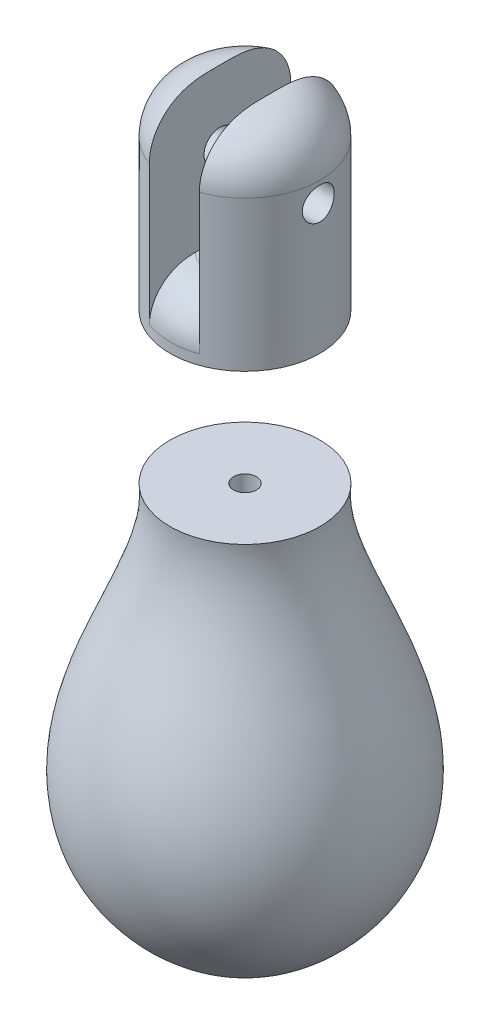
from build123d import *

# Parameters (mm, degrees)
SKETCH1_R               = 7.5
BOSS_EXTRUDE1_DEPTH     = 20
SKETCH2_W               = 15
SKETCH2_H               = 15
CUT_EXTRUDE1_DEPTH      = 2.5
CUT_EXTRUDE2_DEPTH      = 46.499865857
CUT_EXTRUDE2_DEPTH_BACK = 46.499865857
SKETCH7_R               = 1.6
FILLET1_R               = 5
FILLET2_R               = 4
SKETCH8_R               = 1.15
CUT_EXTRUDE3_DEPTH      = 78.581086874
CUT_EXTRUDE4_DEPTH      = 2
SKETCH11_R              = 2.602609251
CUT_EXTRUDE5_DEPTH      = 30


with BuildPart() as part:
    # Sketch1 → Boss-Extrude1 (new body)
    with BuildSketch(Plane(origin=(0, 0, 0), x_dir=(1, 0, 0), z_dir=(0, 1, 0))):
        with Locations(Location((0, 0, 0), (0, 0, 270))):
            Circle(SKETCH1_R)
    extrude(amount=BOSS_EXTRUDE1_DEPTH)

    # Sketch2 → Cut-Extrude1 (cut, symmetric)
    with BuildSketch(Plane(origin=(0, 0, 0), x_dir=(0, 0, -1), z_dir=(1, 0, 0))):
        with Locations((0, 12.5)):
            Rectangle(SKETCH2_W, SKETCH2_H)
    extrude(amount=CUT_EXTRUDE1_DEPTH, both=True, mode=Mode.SUBTRACT)

    # Sketch3 → Revolve1 (revolve)
    with BuildSketch(Plane.XY, mode=Mode.PRIVATE) as revolve1_sk:
        with BuildLine():
            Line((0, 0), (-7.5, 0))
            add(Edge.make_bspline(
                [(-2.602609251, -40), (-6.749714023, -38.80910086), (-13.00965786, -34.1942967), (-15.238669507, -17.061394017), (-6.814702142, -7.291214903), (-7.5, 0)],
                knots=[0, 0, 0, 0, 0.368516647, 0.461988834, 1, 1, 1, 1], degree=3))
            Line((-2.602609251, -40), (0, -40))
            Line((0, -40), (0, 0))
        make_face()
    revolve(revolve1_sk.sketch.rotate(Axis((0, 0, 0), (0, -1, 0)), 70.528779366), axis=Axis((0, 0, 0), (0, -1, 0)))

    # Sketch7 → Cut-Extrude2 (cut, two sides: drawn at the far end of the back side and taken through both)
    with BuildSketch(Plane.ZY.offset(-2.5).offset(-CUT_EXTRUDE2_DEPTH_BACK)):
        with Locations((0, 13)):
            Circle(SKETCH7_R)
    extrude(amount=CUT_EXTRUDE2_DEPTH + CUT_EXTRUDE2_DEPTH_BACK, mode=Mode.SUBTRACT)

    # Fillet1
    fillet1_edges = [part.edges().sort_by_distance(p)[0] for p in [
        (-7.5, 20, 0),
        (7.5, 20, 0),
    ]]
    fillet(fillet1_edges, radius=FILLET1_R - 0.0001)  # a hair under: the kernel refuses the full size

    # Fillet2
    fillet2_edges = [part.edges().sort_by_distance(p)[0] for p in [
        (1.26826484, 5, 7.391989197),
        (0, 5, -7.5),
    ]]
    fillet(fillet2_edges, radius=FILLET2_R)


with BuildPart() as body_2:
    # Split1: the piece on the far side of the plane
    add(part.part)
    split(bisect_by=Plane(origin=(0, 0, 0), x_dir=(-1, 0, 0), z_dir=(0, -1, 0)), keep=Keep.BOTTOM)


with BuildPart() as part_1:
    add(part.part)

    # Split1
    split(bisect_by=Plane(origin=(0, 0, 0), x_dir=(-1, 0, 0), z_dir=(0, -1, 0)), keep=Keep.TOP)


with BuildPart() as body_2_1:
    # Body-Move/Copy1: read off the stored shape, not the designer's step
    # Body-Move/Copy1: moved
    add(body_2.part.moved(Location((0, 15, 0))))


with BuildPart() as cut_extrude3_tool:
    # Sketch8 → Cut-Extrude3 (new, through all)
    with BuildSketch(Plane.XZ.offset(40)):
        Circle(SKETCH8_R)
    extrude(amount=-CUT_EXTRUDE3_DEPTH)


with BuildPart() as part_2:
    add(part_1.part)

    # Cut-Extrude3: cut by cut_extrude3_tool
    add(cut_extrude3_tool.part, mode=Mode.SUBTRACT)

    # Sketch11 → Cut-Extrude5 (cut)
    with BuildSketch(Plane.XZ.offset(40)):
        Circle(SKETCH11_R)
    extrude(amount=-CUT_EXTRUDE5_DEPTH, mode=Mode.SUBTRACT)


with BuildPart() as body_2_2:
    add(body_2_1.part)

    # Cut-Extrude3: cut by cut_extrude3_tool
    add(cut_extrude3_tool.part, mode=Mode.SUBTRACT)

    # Sketch9 → Cut-Extrude4 (cut)
    with BuildSketch(Plane(origin=(0, 20, 0), x_dir=(1, 0, 0), z_dir=(0, 1, 0))):
        Polygon((0, 2.309401077), (-2, 1.154700538), (-2, -1.154700538), (0, -2.309401077), (2, -1.154700538), (2, 1.154700538), align=None)
    extrude(amount=-CUT_EXTRUDE4_DEPTH, mode=Mode.SUBTRACT)


solid = Compound([part_2.part, body_2_2.part])
